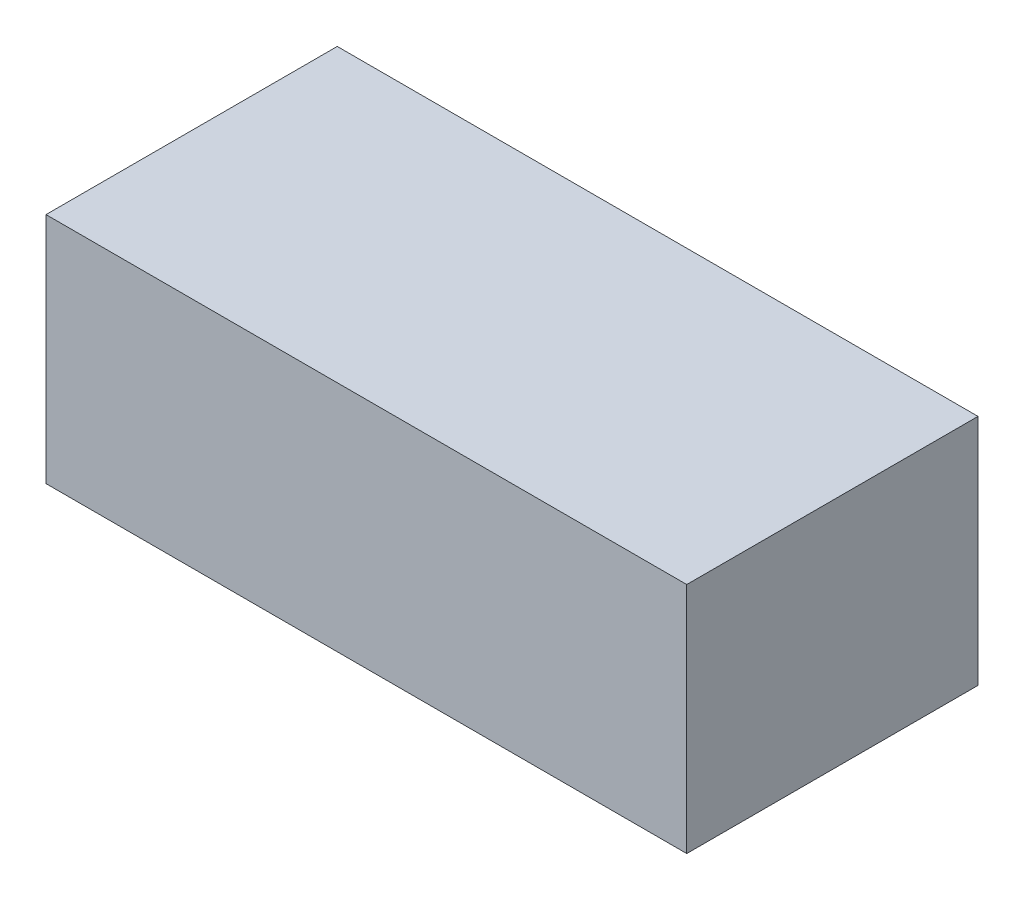
from build123d import *

# Parameters (mm, degrees)
SKETCH_1_W      = 22
SKETCH_1_H      = 10
EXTRUDE_1_DEPTH = 8


with BuildPart() as part:
    # 草图1 → 凸台-拉伸1 (new body)
    with BuildSketch(Plane(origin=(0, 0, 0), x_dir=(1, 0, 0), z_dir=(0, 1, 0))):
        Rectangle(SKETCH_1_W, SKETCH_1_H)
    extrude(amount=EXTRUDE_1_DEPTH)


solid = part.part
